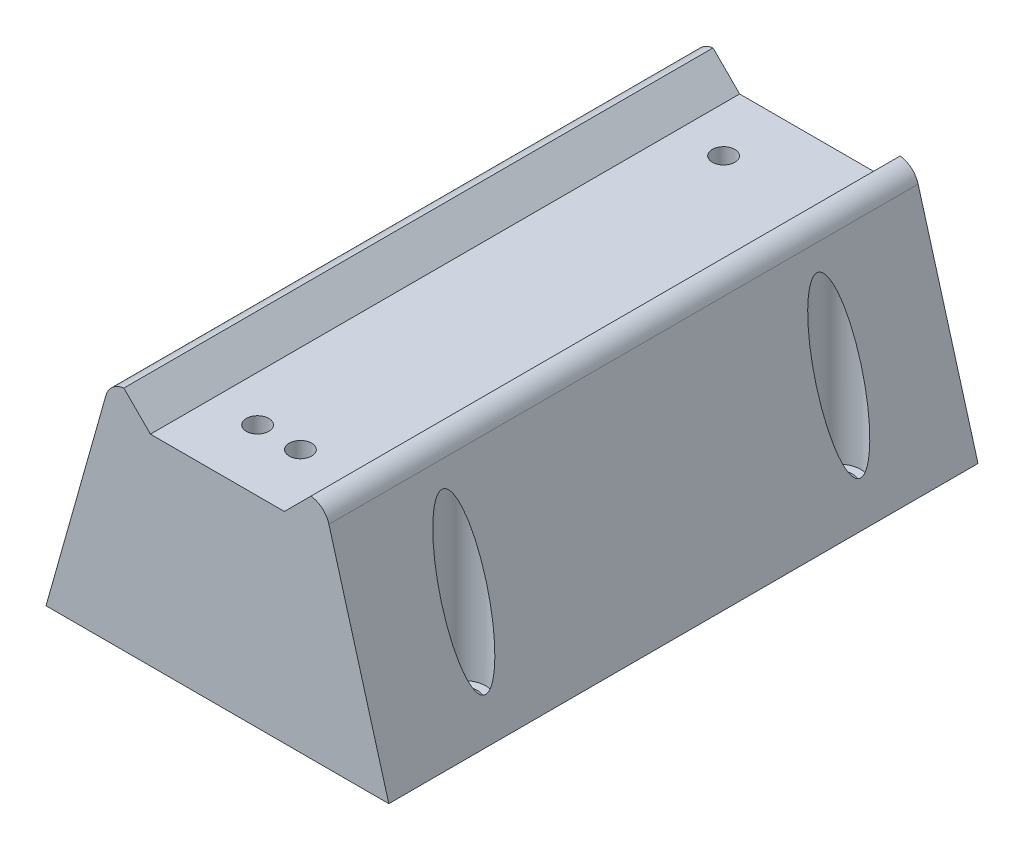
from build123d import *

# Parameters (mm, degrees)
BOSS_EXTRUDE1_DEPTH  = 25
BOSS_EXTRUDE2_DEPTH  = 2.5
SKETCH5_W            = 20
SKETCH5_H            = 7.5
SKETCH5_W_2          = 7.54
SKETCH5_H_2          = 3.54
SKETCH5_W_3          = 3.54
BOSS_EXTRUDE3_DEPTH  = 10
SKETCH6_R            = 1.0485
CUT_EXTRUDE1_DEPTH   = 39.259802665
FILLET1_R            = 2
M2_CLEARANCE_HOLE1_D = 2.6
SKETCH9_R            = 2.05
CUT_EXTRUDE4_DEPTH   = 38.186186952
SKETCH10_W           = 12.5
SKETCH10_H           = 55
CUT_EXTRUDE5_DEPTH   = 2.5
CHAMFER1_SIZE        = 2.5


with BuildPart() as part:
    # Sketch2 → Boss-Extrude1 (new, symmetric)
    with BuildSketch(Plane.XY):
        Polygon((10, -2.5), (10, -18.75), (16, -18.75), (10, 2.5), (-10, 2.5), (-16, -18.75), (-10, -18.75), (-10, -2.5), align=None)
    extrude(amount=BOSS_EXTRUDE1_DEPTH, both=True)

    # Sketch3 → Boss-Extrude2 (add)
    with BuildSketch(Plane.XY.offset(25)):
        Polygon((-10, -18.75), (10, -18.75), (16, -18.75), (10, 2.5), (-10, 2.5), (-16, -18.75), align=None)
    boss_extrude2 = extrude(amount=BOSS_EXTRUDE2_DEPTH)

    # Mirror1: Boss-Extrude2 across plane
    add(boss_extrude2.mirror(Plane.XY))

    # Sketch5 → Boss-Extrude3 (add)
    # profile 1 of 2: a face of its own
    with BuildSketch(Plane.XZ.offset(2.5)):
        with Locations((0, 21.25)):
            Rectangle(SKETCH5_W, SKETCH5_H)
        with Locations((0, 21.75)):
            Rectangle(SKETCH5_W_2, SKETCH5_H_2, mode=Mode.SUBTRACT)
    # profile 2 of 2: a face of its own
    with BuildSketch(Plane.XZ.offset(2.5)):
        with Locations((0, -21.25)):
            Rectangle(SKETCH5_W, SKETCH5_H)
        with Locations((-2, -21.75)):
            Rectangle(SKETCH5_W_3, SKETCH5_H_2, mode=Mode.SUBTRACT)
    extrude(amount=BOSS_EXTRUDE3_DEPTH)

    # Sketch6 → Cut-Extrude1 (cut, through all)
    with BuildSketch(Plane(origin=(0, 2.5, 0), x_dir=(1, 0, 0), z_dir=(0, 1, 0))):
        with Locations(Location((-2, 21.75, 0), (0, 0, 270))):
            Circle(SKETCH6_R)
        with Locations(Location((-2, -21.75, 0), (0, 0, 270))):
            Circle(SKETCH6_R)
        with Locations(Location((2, -21.75, 0), (0, 0, 270))):
            Circle(SKETCH6_R)
    extrude(amount=-CUT_EXTRUDE1_DEPTH, mode=Mode.SUBTRACT)

    # Fillet1
    fillet1_edges = [part.edges().sort_by_distance(p)[0] for p in [
        (-10, 2.5, 0),
        (10, 2.5, 0),
        (10, -2.5, 0),
        (-10, -2.5, 0),
        (0, -12.5, 17.5),
        (0, -12.5, -17.5),
    ]]
    fillet(fillet1_edges, radius=FILLET1_R)

    # M2 Clearance Hole1 (through all)
    with Locations(Plane.XZ.offset(18.75)):
        with Locations((-13, 17.5), (13, 17.5), (13, -17.5), (-13, -17.5)):
            Hole(M2_CLEARANCE_HOLE1_D / 2)

    # Sketch9 → Cut-Extrude4 (cut, through all)
    with BuildSketch(Plane.XZ.offset(16.75)):
        with Locations((-13, -17.5)):
            Circle(SKETCH9_R)
        with Locations((13, -17.5)):
            Circle(SKETCH9_R)
        with Locations((13, 17.5)):
            Circle(SKETCH9_R)
        with Locations((-13, 17.5)):
            Circle(SKETCH9_R)
    extrude(amount=-CUT_EXTRUDE4_DEPTH, mode=Mode.SUBTRACT)

    # Sketch10 → Cut-Extrude5 (cut)
    with BuildSketch(Plane(origin=(0, 2.5, 0), x_dir=(1, 0, 0), z_dir=(0, 1, 0))):
        Rectangle(SKETCH10_W, SKETCH10_H)
    extrude(amount=-CUT_EXTRUDE5_DEPTH, mode=Mode.SUBTRACT)

    # Chamfer1
    # the kernel refuses this chamfer: 2.5 mm, written as the material it takes off along each edge
    with BuildSketch(Plane(origin=(6.25, 2.5, 33.92920747), x_dir=(-0.027495876610586317, -0.9996219169112968, 0), z_dir=(0, 0, -1))) as chamfer1_piece_1_section:
        Polygon((CHAMFER1_SIZE * 0.999621916911, -CHAMFER1_SIZE * 0.0274958766106), (-CHAMFER1_SIZE * 0.0274958766106, -CHAMFER1_SIZE * 0.999621916911), (0, 0), align=None)
    chamfer1_piece_1 = extrude(amount=67.85841494, mode=Mode.PRIVATE)
    chamfer1_piece_1 = split(chamfer1_piece_1, bisect_by=Plane(origin=(7.076010386, 0, 0), z_dir=(0, 1, 0)), keep=Keep.TOP, mode=Mode.PRIVATE)
    add(chamfer1_piece_1, mode=Mode.SUBTRACT)
    with BuildSketch(Plane(origin=(-6.25, 2.5, -33.92920747), x_dir=(-0.9996219169112968, 0.02749587661058649, 0), z_dir=(0, 0, 1))) as chamfer1_piece_2_section:
        Polygon((CHAMFER1_SIZE * 0.999621916911, CHAMFER1_SIZE * 0.0274958766106), (-CHAMFER1_SIZE * 0.0274958766106, CHAMFER1_SIZE * 0.999621916911), (0, 0), align=None)
    chamfer1_piece_2 = extrude(amount=67.85841494, mode=Mode.PRIVATE)
    chamfer1_piece_2 = split(chamfer1_piece_2, bisect_by=Plane(origin=(-7.076010386, 0, 0), z_dir=(0, 1, 0)), keep=Keep.TOP, mode=Mode.PRIVATE)
    add(chamfer1_piece_2, mode=Mode.SUBTRACT)


solid = part.part
